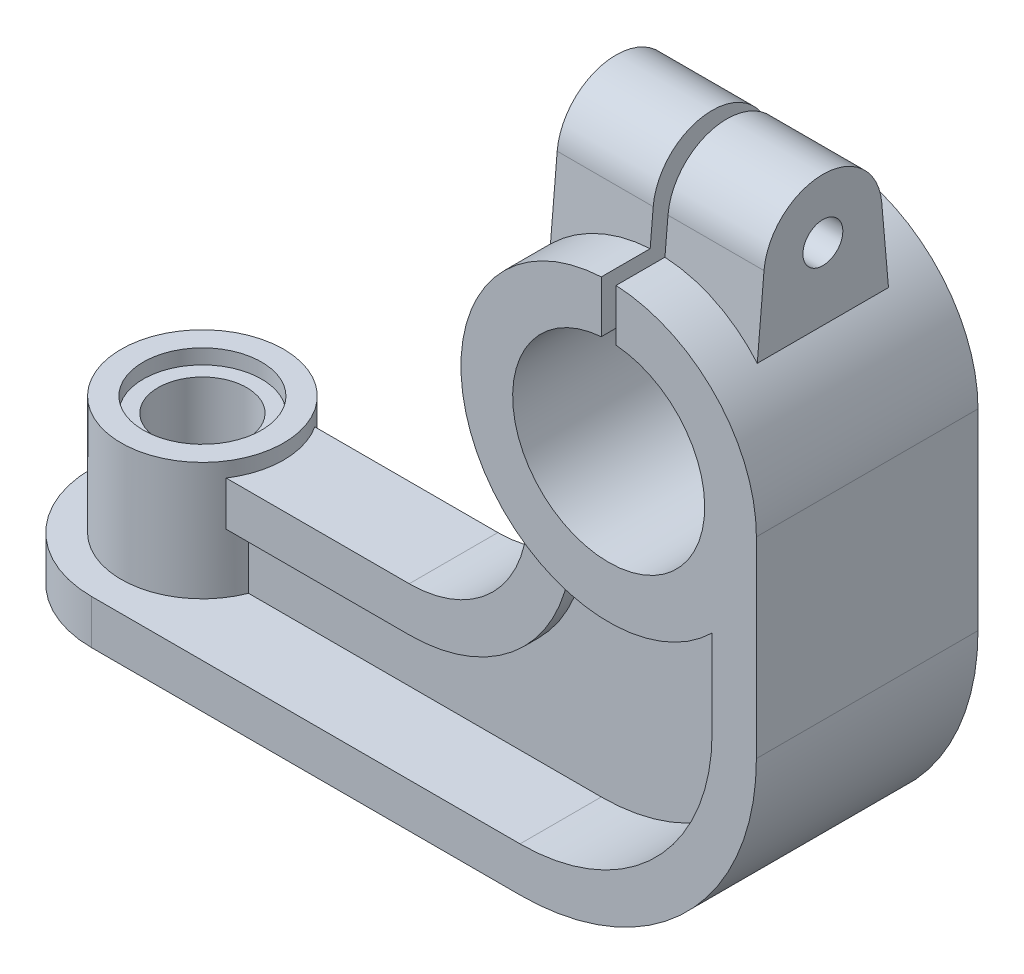
from build123d import *
from build123d.topology import SkipClean

# Parameters (mm, degrees)
BOSS_EXTRUDE1_DEPTH     = 10
SKETCH1_3_R             = 50
BOSS_EXTRUDE2_DEPTH     = 37.5
BOSS_EXTRUDE3_DEPTH     = 15
BOSS_EXTRUDE4_DEPTH     = 37.5
BOSS_EXTRUDE5_DEPTH     = 35
CUT_EXTRUDE1_DEPTH      = 312.749097833
CUT_EXTRUDE1_DEPTH_BACK = 312.749097833
SKETCH12_R              = 32.5
SKETCH12_W              = 5
SKETCH12_H              = 95


with BuildPart() as part:
    # Sketch1 → Boss-Extrude1 (new, symmetric)
    with BuildSketch(Plane.XY):
        with BuildLine():
            Line((50, 145), (50, 80))
            ThreePointArc((50, 80), (26.568542495, 23.431457505), (-30, 0))
            Line((-30, 0), (-175, 0))
            Line((-175, 0), (-175, 50))
            Line((-175, 50), (-90, 50))
            ThreePointArc((-90, 50), (-61.715728753, 61.715728753), (-50, 90))
            Line((-50, 90), (-50, 145))
            Line((-50, 145), (50, 145))
        make_face()
    extrude(amount=BOSS_EXTRUDE1_DEPTH, both=True)

    # Sketch1<3> → Boss-Extrude2 (add, symmetric)
    with BuildSketch(Plane.XY):
        with Locations((0, 145)):
            Circle(SKETCH1_3_R)
    extrude(amount=BOSS_EXTRUDE2_DEPTH, both=True)

    # Sketch2 → Boss-Extrude3 (add, symmetric)
    with SkipClean():  # the faces are left unmerged after this step: merging them gives an invalid solid
        with BuildSketch(Plane.XY):
            with BuildLine():
                ThreePointArc((-90, 35), (-51.109127035, 51.109127035), (-35, 90))
                Line((-35, 90), (-35, 145))
                Line((-35, 145), (-50, 145))
                Line((-50, 145), (-50, 90))
                ThreePointArc((-50, 90), (-61.715728753, 61.715728753), (-90, 50))
                Line((-90, 50), (-175, 50))
                Line((-175, 50), (-175, 35))
                Line((-175, 35), (-90, 35))
            make_face()
        extrude(amount=BOSS_EXTRUDE3_DEPTH, both=True)
    add(part.part.scale(1), mode=Mode.REPLACE)  # the faces are merged on a copy

    # Sketch2<3> → Boss-Extrude4 (add, symmetric)
    with SkipClean():  # the faces are left unmerged after this step: merging them gives an invalid solid
        with BuildSketch(Plane.XY):
            with BuildLine():
                Line((-30, 15), (-175, 15))
                Line((-175, 15), (-175, 0))
                Line((-175, 0), (-30, 0))
                ThreePointArc((-30, 0), (26.568542495, 23.431457505), (50, 80))
                Line((50, 80), (50, 145))
                Line((50, 145), (35, 145))
                Line((35, 145), (35, 80))
                ThreePointArc((35, 80), (15.961940777, 34.038059223), (-30, 15))
            make_face()
        extrude(amount=BOSS_EXTRUDE4_DEPTH, both=True)
    add(part.part.scale(1), mode=Mode.REPLACE)  # the faces are merged on a copy

    # Sketch4 → Revolve1 (revolve)
    with BuildSketch(Plane.XY):
        Polygon((-175, 55), (-202.5, 55), (-202.5, 15), (-212.5, 15), (-212.5, 0), (-175, 0), align=None)
    revolve(axis=Axis((-175, 0, 0), (0, 1, 0)))

    # Sketch6 → Boss-Extrude5 (add, symmetric)
    with BuildSketch(Plane(origin=(0, 0, 0), x_dir=(0, 0, -1), z_dir=(1, 0, 0))):
        with BuildLine():
            Line((-25.325716562, 145), (25.325716562, 145))
            Line((25.325716562, 145), (19.923893962, 206.743114855))
            ThreePointArc((19.923893962, 206.743114855), (0, 225), (-19.923893962, 206.743114855))
            Line((-19.923893962, 206.743114855), (-25.325716562, 145))
        make_face()
    extrude(amount=BOSS_EXTRUDE5_DEPTH, both=True)

    # Sketch11 → CBORE for M12 SBHCS1 (revolve, cut)
    with BuildSketch(Plane(origin=(-35, 205, 0), x_dir=(0, 0, 1), z_dir=(0, 1, 0))):
        Polygon((0, 0), (0, 85), (6.75, 85), (6.75, 6.6), (11, 6.6), (11, 0.025), (11.025, 0), align=None)
    revolve(axis=Axis((-41.35, 205, 0), (1, 0, 0)), mode=Mode.SUBTRACT)

    # Sketch12 → Cut-Extrude1 (cut, two sides: drawn at the far end of the back side and taken through both)
    with BuildSketch(Plane.XY.offset(-CUT_EXTRUDE1_DEPTH_BACK)):
        with Locations((0, 145)):
            Circle(SKETCH12_R)
        with Locations((0, 177.5)):
            Rectangle(SKETCH12_W, SKETCH12_H)
    extrude(amount=CUT_EXTRUDE1_DEPTH + CUT_EXTRUDE1_DEPTH_BACK, mode=Mode.SUBTRACT)

    # Sketch13 → Cut-Revolve1 (revolve, cut)
    with BuildSketch(Plane.XY):
        Polygon((-175, 0), (-200, 0), (-200, 5), (-190, 5), (-190, 50), (-195, 50), (-195, 55), (-175, 55), align=None)
    revolve(axis=Axis((-175, 55, 0), (0, -1, 0)), mode=Mode.SUBTRACT)


solid = part.part
